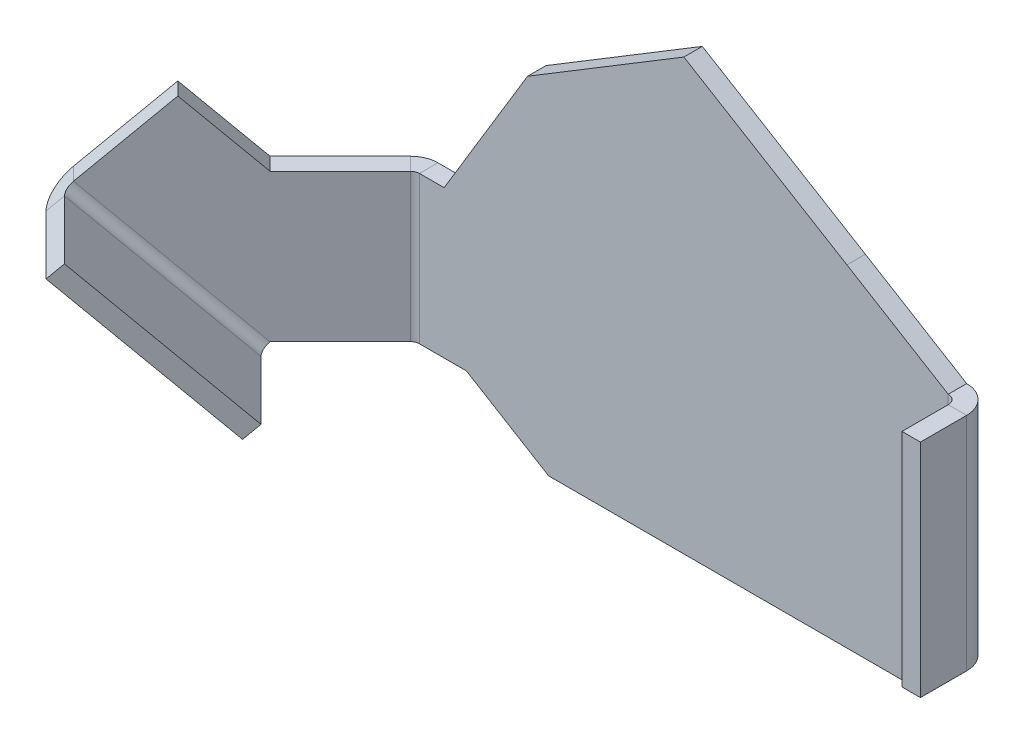
from build123d import *

# Parameters (mm, degrees)
CROQUIS1_W              = 43
CROQUIS1_H              = 35
BRIDA_BASE1_DEPTH       = 1.5
CROQUIS6_W              = 59.566817112
CROQUIS6_H              = 45.88022185
CORTAR_EXTRUIR1_DEPTH   = 10
BRIDA_DE_ARISTA1_DEPTH  = 18
BRIDA_DE_ARISTA2_DEPTH  = 12
CORTAR_EXTRUIR2_DEPTH   = 10
SALIENTE_EXTRUIR1_DEPTH = 1.5
CORTAR_EXTRUIR3_DEPTH   = 10
BRIDA_DE_ARISTA3_DEPTH  = 15.985281374


# Sheet-metal steps are written as plain solids
with BuildPart() as part:
    # Croquis1 → Brida base1 (new body)
    with BuildSketch(Plane.XY):
        Rectangle(CROQUIS1_W, CROQUIS1_H)
    extrude(amount=-BRIDA_BASE1_DEPTH)

    # Croquis6 → Cortar-Extruir1 (cut)
    with BuildSketch(Plane.XY):
        Rectangle(CROQUIS6_W, CROQUIS6_H)
        Polygon((19.5, -17.5), (21.5, -13.5), (21.5, 4.5), (13.260768396, 9.49227982), (0, 17.5), (-12.711890801, 9.791095082), (-19.5, -1.45), (-21.5, -1.45), (-21.5, -13.45), (-17.684098087, -13.45), (-11, -17.5), align=None, mode=Mode.SUBTRACT)
    extrude(amount=-CORTAR_EXTRUIR1_DEPTH, mode=Mode.SUBTRACT)

    # Brida de arista1 section (across the edge) → Brida de arista1 (add)
    with BuildSketch(Plane(origin=(22.2366, -13.5, 0), x_dir=(-1, 0, 0), z_dir=(0, 1, 0))):
        with BuildLine():
            Line((-1.5, 0.7366), (-1.5, 4.5))
            Line((-1.5, 4.5), (0, 4.5))
            Line((0, 4.5), (0, 0.7366))
            ThreePointArc((0, 0.7366), (0.215745145, 0.215745145), (0.7366, 0))
            Line((0.7366, 0), (0.7366, -1.5))
            ThreePointArc((0.7366, -1.5), (-0.844915027, -0.844915027), (-1.5, 0.7366))
        make_face()
    extrude(amount=BRIDA_DE_ARISTA1_DEPTH)

    # Brida de arista2 section (across the edge) → Brida de arista2 (add)
    with BuildSketch(Plane(origin=(-21.80510971, -1.45, 0), x_dir=(0.7071067811865438, 0, 0.7071067811865512), z_dir=(0, -1, 0))):
        with BuildLine():
            Line((-1.5, 0.30510971), (-1.5, 20.378679656))
            Line((-1.5, 20.378679656), (0, 20.378679656))
            Line((0, 20.378679656), (0, 0.30510971))
            ThreePointArc((0, 0.30510971), (0.056070336, 0.023225094), (0.215745145, -0.215745145))
            Line((0.215745145, -0.215745145), (-0.844915027, -1.276405317))
            ThreePointArc((-0.844915027, -1.276405317), (-1.329748962, -0.550800055), (-1.5, 0.30510971))
        make_face()
    extrude(amount=BRIDA_DE_ARISTA2_DEPTH)

    # Croquis13 → Cortar-Extruir2 (cut)
    with BuildSketch(Plane(origin=(-11.963215027, 0, -11.963215027), x_dir=(-0.7071067811865511, 0, 0.707106781186544), z_dir=(-0.707106781186544, 0, -0.7071067811865511))):
        Polygon((35.797220597, -1.45), (21.51312871, -15.734091887), (35.797220597, -15.734091887), align=None)
    extrude(amount=-CORTAR_EXTRUIR2_DEPTH, mode=Mode.SUBTRACT)

    # Croquis14 → Saliente-Extruir1 (add)
    with BuildSketch(Plane(origin=(-11.963215027, 0, -11.963215027), x_dir=(-0.7071067811865511, 0, 0.707106781186544), z_dir=(-0.707106781186544, 0, -0.7071067811865511))):
        Polygon((23.797220597, -1.45), (30.161181628, 4.913961031), (36.161181628, -1.086038969), (35.797220597, -1.45), align=None)
    extrude(amount=-SALIENTE_EXTRUIR1_DEPTH)

    # Croquis15 → Cortar-Extruir3 (cut)
    with BuildSketch(Plane(origin=(-11.963215027, 0, -11.963215027), x_dir=(-0.7071067811865511, 0, 0.707106781186544), z_dir=(-0.707106781186544, 0, -0.7071067811865511))):
        Polygon((30.161181628, 4.913961031), (36.161181628, -1.086038969), (35.100521456, -2.146699141), (29.100521456, 3.853300859), align=None)
    extrude(amount=-CORTAR_EXTRUIR3_DEPTH, mode=Mode.SUBTRACT)

    # Brida de arista3 section (across the edge) → Brida de arista3 (add)
    with BuildSketch(Plane(origin=(-36.0906716, -2.667553996, 14.28556189), x_dir=(0.5000000000000052, 0.7071067811865475, -0.499999999999995), z_dir=(0.5000000000000028, -0.7071067811865477, -0.49999999999999717))):
        with BuildLine():
            Line((-1.5, 0.7366), (-1.5, 7.5))
            Line((-1.5, 7.5), (0, 7.5))
            Line((0, 7.5), (0, 0.7366))
            ThreePointArc((0, 0.7366), (0.215745145, 0.215745145), (0.7366, 0))
            Line((0.7366, 0), (0.7366, -1.5))
            ThreePointArc((0.7366, -1.5), (-0.844915027, -0.844915027), (-1.5, 0.7366))
        make_face()
    extrude(amount=BRIDA_DE_ARISTA3_DEPTH)


solid = part.part
